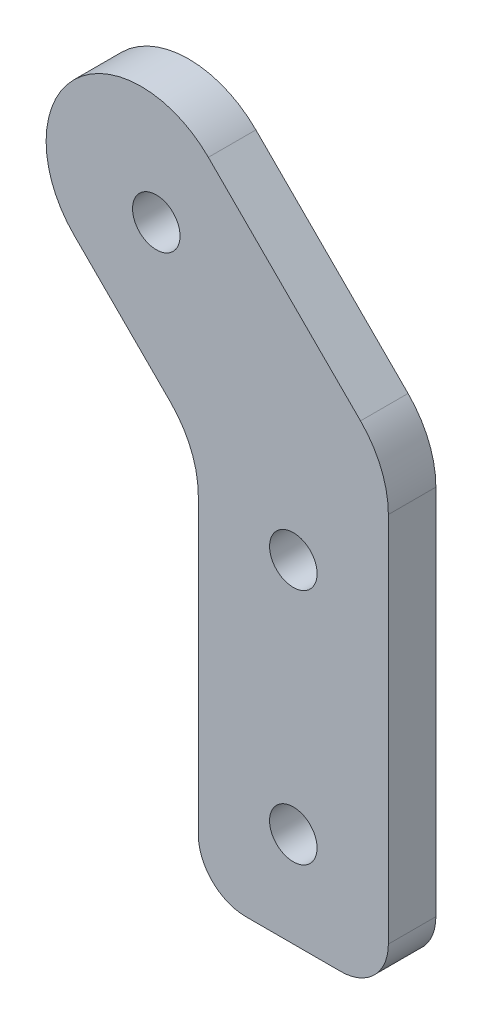
from build123d import *

# Parameters (mm, degrees)
SKETCH1_R           = 2.5
BOSS_EXTRUDE1_DEPTH = 5
FILLET1_R           = 10
FILLET2_R           = 5


with BuildPart() as part:
    # Sketch1 → Boss-Extrude1 (new body)
    with BuildSketch(Plane.XY):
        Polygon((0, 0), (0, 40), (-20.152940401, 60.152940401), (-6.010804777, 74.295076025), (20, 48.284271247), (20, 0), align=None)
        with Locations((10, 10)):
            Circle(SKETCH1_R, mode=Mode.SUBTRACT)
        with Locations((10, 35)):
            Circle(SKETCH1_R, mode=Mode.SUBTRACT)
        with Locations((-4.419570665, 58.561706289)):
            Circle(SKETCH1_R, mode=Mode.SUBTRACT)
    extrude(amount=BOSS_EXTRUDE1_DEPTH)

    # Fillet1
    fillet1_edges = [part.edges().sort_by_distance(p)[0] for p in [
        (20, 48.284271247, 2.5),
        (0, 40, 2.5),
        (-20.152940401, 60.152940401, 2.5),
        (-6.010804777, 74.295076025, 2.5),
    ]]
    fillet(fillet1_edges, radius=FILLET1_R - 0.0001)  # a hair under: the kernel refuses the full size

    # Fillet2
    fillet2_edges = [part.edges().sort_by_distance(p)[0] for p in [
        (0, 0, 2.5),
        (20, 0, 2.5),
    ]]
    fillet(fillet2_edges, radius=FILLET2_R)


solid = part.part
